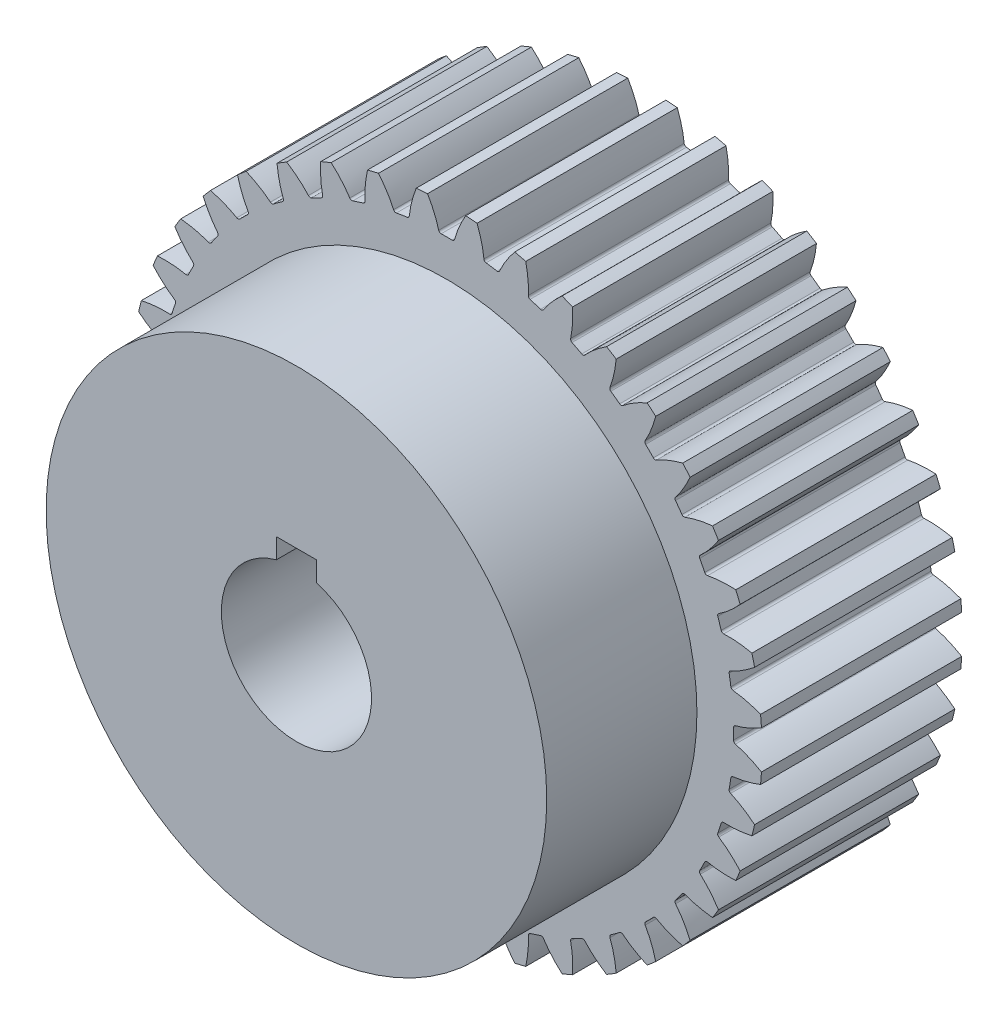
from build123d import *

# Parameters (mm, degrees)
SKETCH1_R                = 31.5
BOSS_EXTRUDE1_DEPTH      = 20
CUT_EXTRUDE2_DEPTH       = 49.831342394
FILLET1_R                = 0.25
CIRPATTERN1_COUNT        = 40
FILLET1_OF_CIRPATTERN1_R = 0.25
SKETCH1_8_R              = 25
BOSS_EXTRUDE2_DEPTH      = 35
SKETCH2_R                = 7.5
CUT_EXTRUDE4_DEPTH       = 57.588251431
SKETCH6_W                = 4
SKETCH6_H                = 2
CUT_EXTRUDE5_DEPTH       = 57.588251492


with BuildPart() as part:
    # Sketch1 → Boss-Extrude1 (new body)
    with BuildSketch(Plane.XY):
        Circle(SKETCH1_R)
    extrude(amount=BOSS_EXTRUDE1_DEPTH)

    # Sketch1<5> → Cut-Extrude2 (cut, through all)
    with BuildSketch(Plane.XY):
        with BuildLine():
            add(Edge.make_bspline(
                [(-1.906543024, 31.442250137), (-1.695696445, 31.078842528), (-1.308431171, 30.336664954), (-0.941741922, 29.392730706), (-0.785074835, 28.820981083), (-0.748482141, 28.649753144)],
                knots=[0.31361624, 0.31361624, 0.31361624, 0.31361624, 0.385710722, 0.457140092, 0.487211711, 0.487211711, 0.487211711, 0.487211711], degree=3))
            ThreePointArc((-0.748482141, 28.649753144), (0, 28.65952862), (0.748482141, 28.649753144))
            add(Edge.make_bspline(
                [(1.906543024, 31.442250137), (1.695696445, 31.078842528), (1.308431171, 30.336664954), (0.941741922, 29.392730706), (0.785074835, 28.820981083), (0.748482141, 28.649753144)],
                knots=[0.31361624, 0.31361624, 0.31361624, 0.31361624, 0.385710722, 0.457140092, 0.487211711, 0.487211711, 0.487211711, 0.487211711], degree=3))
            ThreePointArc((1.906543024, 31.442250137), (0, 31.5), (-1.906543024, 31.442250137))
        make_face()
    cut_extrude2 = extrude(amount=CUT_EXTRUDE2_DEPTH, mode=Mode.SUBTRACT)

    # Fillet1
    fillet1_edges = [part.edges().sort_by_distance(p)[0] for p in [
        (0.748482141, 28.649753144, 10),
        (-0.748482141, 28.649753144, 10),
    ]]
    fillet(fillet1_edges, radius=FILLET1_R)

    # CirPattern1: Cut-Extrude2 ×40 about axis
    cirpattern1_axis = Axis((0, 0, 20), (0, 0, -1))
    for i in range(1, CIRPATTERN1_COUNT):
        add(cut_extrude2.rotate(cirpattern1_axis, i * 360 / CIRPATTERN1_COUNT), mode=Mode.SUBTRACT)

    # Fillet1 of CirPattern1
    fillet1_of_cirpattern1_edges = [part.edges().sort_by_distance(p)[0] for p in [
        (5.22107589, 28.179938738, 10),
        (3.742541723, 28.414115544, 10),
        (9.565109423, 27.016240716, 10),
        (8.141411789, 27.478828119, 10),
        (13.673618218, 25.187313187, 10),
        (12.339813277, 25.866920749, 10),
        (17.445437151, 22.738190414, 10),
        (16.234367608, 23.618083942, 10),
        (20.787691525, 19.72917793, 10),
        (19.72917793, 20.787691525, 10),
        (23.618083942, 16.234367608, 10),
        (22.738190414, 17.445437151, 10),
        (25.866920749, 12.339813277, 10),
        (25.187313187, 13.673618218, 10),
        (27.478828119, 8.141411789, 10),
        (27.016240716, 9.565109423, 10),
        (28.414115544, 3.742541723, 10),
        (28.179938738, 5.22107589, 10),
        (28.649753144, -0.748482141, 10),
        (28.649753144, 0.748482141, 10),
        (28.179938738, -5.22107589, 10),
        (28.414115544, -3.742541723, 10),
        (27.016240716, -9.565109423, 10),
        (27.478828119, -8.141411789, 10),
        (25.187313187, -13.673618218, 10),
        (25.866920749, -12.339813277, 10),
        (22.738190414, -17.445437151, 10),
        (23.618083942, -16.234367608, 10),
        (19.72917793, -20.787691525, 10),
        (20.787691525, -19.72917793, 10),
        (16.234367608, -23.618083942, 10),
        (17.445437151, -22.738190414, 10),
        (12.339813277, -25.866920749, 10),
        (13.673618218, -25.187313187, 10),
        (8.141411789, -27.478828119, 10),
        (9.565109423, -27.016240716, 10),
        (3.742541723, -28.414115544, 10),
        (5.22107589, -28.179938738, 10),
        (-0.748482141, -28.649753144, 10),
        (0.748482141, -28.649753144, 10),
        (-5.22107589, -28.179938738, 10),
        (-3.742541723, -28.414115544, 10),
        (-9.565109423, -27.016240716, 10),
        (-8.141411789, -27.478828119, 10),
        (-13.673618218, -25.187313187, 10),
        (-12.339813277, -25.866920749, 10),
        (-17.445437151, -22.738190414, 10),
        (-16.234367608, -23.618083942, 10),
        (-20.787691525, -19.72917793, 10),
        (-19.72917793, -20.787691525, 10),
        (-23.618083942, -16.234367608, 10),
        (-22.738190414, -17.445437151, 10),
        (-25.866920749, -12.339813277, 10),
        (-25.187313187, -13.673618218, 10),
        (-27.478828119, -8.141411789, 10),
        (-27.016240716, -9.565109423, 10),
        (-28.414115544, -3.742541723, 10),
        (-28.179938738, -5.22107589, 10),
        (-28.649753144, 0.748482141, 10),
        (-28.649753144, -0.748482141, 10),
        (-28.179938738, 5.22107589, 10),
        (-28.414115544, 3.742541723, 10),
        (-27.016240716, 9.565109423, 10),
        (-27.478828119, 8.141411789, 10),
        (-25.187313187, 13.673618218, 10),
        (-25.866920749, 12.339813277, 10),
        (-22.738190414, 17.445437151, 10),
        (-23.618083942, 16.234367608, 10),
        (-19.72917793, 20.787691525, 10),
        (-20.787691525, 19.72917793, 10),
        (-16.234367608, 23.618083942, 10),
        (-17.445437151, 22.738190414, 10),
        (-12.339813277, 25.866920749, 10),
        (-13.673618218, 25.187313187, 10),
        (-8.141411789, 27.478828119, 10),
        (-9.565109423, 27.016240716, 10),
        (-3.742541723, 28.414115544, 10),
        (-5.22107589, 28.179938738, 10),
    ]]
    fillet(fillet1_of_cirpattern1_edges, radius=FILLET1_OF_CIRPATTERN1_R)

    # Sketch1<8> → Boss-Extrude2 (add)
    with BuildSketch(Plane.XY):
        Circle(SKETCH1_8_R)
    extrude(amount=BOSS_EXTRUDE2_DEPTH)

    # Sketch2 → Cut-Extrude4 (cut, through all)
    with BuildSketch(Plane(origin=(0, 0, 0), x_dir=(-1, 0, 0), z_dir=(0, 0, -1))):
        Circle(SKETCH2_R)
    extrude(amount=-CUT_EXTRUDE4_DEPTH, mode=Mode.SUBTRACT)

    # Sketch6 → Cut-Extrude5 (cut, through all)
    with BuildSketch(Plane.XY.offset(35)):
        with Locations((0, 8.228416147)):
            Rectangle(SKETCH6_W, SKETCH6_H)
    extrude(amount=-CUT_EXTRUDE5_DEPTH, mode=Mode.SUBTRACT)


solid = part.part
